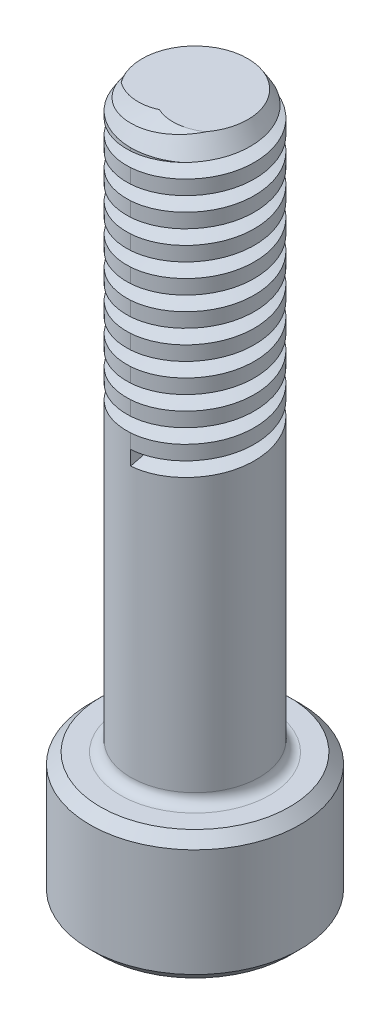
from build123d import *

# Parameters (mm, degrees)
CUT_SWEEP1_PITCH   = 0.635
CUT_EXTRUDE1_DEPTH = 1.2954
FILLET1_R          = 0.2286
FILLET2_R          = 0.396875794
CHAMFER2_SIZE      = 0.2286
CHAMFER3_SIZE      = 0.127


with BuildPart() as part:
    # Sketch1 → Revolve1 (revolve)
    with BuildSketch(Plane.XY, mode=Mode.PRIVATE) as revolve1_sk:
        Polygon((0, 0), (0, 15.5448), (1.4224, 15.5448), (1.4224, 2.8448), (2.3241, 2.8448), (2.3241, 0), align=None)
    revolve(revolve1_sk.sketch.rotate(Axis((0, 0, 0), (0, 1, 0)), 90), axis=Axis((0, 0, 0), (0, 1, 0)))

    # Cut-Sweep1: arcs per turn and ends read off the stored shape
    # Cut-Sweep1: the profile of Sketch3 profile screwed along a right-hand helix through 11 turns, 6 arcs to a turn; built about Z, then put on its axis
    cut_sweep1_z = Axis((0, 0, 0), (0, 0, 1))
    cut_sweep1_corners = [(1.4227, 0, -0.476175), (1.4227, 0, -0.793825), (0.78739873, 0, -0.635)]
    with BuildLine(mode=Mode.PRIVATE) as cut_sweep1_profile:
        Line(cut_sweep1_corners[0], cut_sweep1_corners[1])
        Line(cut_sweep1_corners[1], cut_sweep1_corners[2])
        Line(cut_sweep1_corners[2], cut_sweep1_corners[0])
    cut_sweep1_cap = Face(cut_sweep1_profile.wire())
    cut_sweep1_turn_angles = [0, 30, 60, 90, 120, 150, 180, 210, 240, 270, 300, 330, 360]
    cut_sweep1_turn_weights = [1, 0.8660254037844387, 1, 0.8660254037844387, 1, 0.8660254037844387, 1, 0.8660254037844387, 1, 0.8660254037844387, 1, 0.8660254037844387, 1]
    cut_sweep1_turn_rails = [Edge.make_bspline([Vector(p[0], p[1], 0).rotate(cut_sweep1_z, cut_sweep1_turn_angles[k]) / cut_sweep1_turn_weights[k] + Vector(0, 0, p[2] + CUT_SWEEP1_PITCH * cut_sweep1_turn_angles[k] / 360) for k in range(13)], [0, 0, 0, 1, 1, 2, 2, 3, 3, 4, 4, 5, 5, 6, 6, 6], 2, cut_sweep1_turn_weights) for p in cut_sweep1_corners]
    cut_sweep1_turn_sides = [Face.make_surface_from_curves(cut_sweep1_turn_rails[p[0]], cut_sweep1_turn_rails[p[1]]) for p in [(0, 1), (1, 2), (2, 0)]]
    cut_sweep1 = Plane(origin=(0, 15.5448, 0), x_dir=(0, 0, 1), z_dir=(0, -1, 0)) * Solid(Shell([*[p.moved(Location((0, 0, CUT_SWEEP1_PITCH * i))) for i in range(11) for p in cut_sweep1_turn_sides], cut_sweep1_cap, cut_sweep1_cap.rotate(cut_sweep1_z, 3960).moved(Location((0, 0, CUT_SWEEP1_PITCH * 3960 / 360)))]))
    add(cut_sweep1, mode=Mode.SUBTRACT)

    # Sketch4 → Cut-Extrude1 (cut)
    with BuildSketch(Plane(origin=(0, 0, 0), x_dir=(1, 0, 0), z_dir=(0, 1, 0))):
        Polygon((0, 1.378481503), (-1.1938, 0.689240751), (-1.1938, -0.689240751), (0, -1.378481503), (1.1938, -0.689240751), (1.1938, 0.689240751), align=None)
    extrude(amount=CUT_EXTRUDE1_DEPTH, mode=Mode.SUBTRACT)

    # Fillet1
    fillet1_edges = [part.edges().sort_by_distance(p)[0] for p in [
        (0, 2.8448, 1.4224),
    ]]
    fillet(fillet1_edges, radius=FILLET1_R)

    # Fillet2
    fillet2_edges = [part.edges().sort_by_distance(p)[0] for p in [
        (1.1938, 0.6477, -0.689240751),
        (0, 0.6477, -1.378481503),
        (-1.1938, 0.6477, -0.689240751),
        (-1.1938, 0.6477, 0.689240751),
        (0, 0.6477, 1.378481503),
        (1.1938, 0.6477, 0.689240751),
        (0.5969, 1.2954, -1.033861127),
        (-0.5969, 1.2954, -1.033861127),
        (-1.1938, 1.2954, 0),
        (-0.5969, 1.2954, 1.033861127),
        (0.5969, 1.2954, 1.033861127),
        (1.1938, 1.2954, 0),
    ]]
    fillet(fillet2_edges, radius=FILLET2_R)

    # Chamfer1: read off the stored shape, not the designer's step
    # Chamfer1 outline → Chamfer1 (revolve, cut)
    with BuildSketch(Plane.XY):
        Polygon((1.4224, 15.5448), (1.168399492, 15.5448), (1.4224, 15.133376279), align=None)
    revolve(axis=Axis((0, 0, 0), (0, 1, 0)), mode=Mode.SUBTRACT)

    # Chamfer2
    chamfer2_edges = [part.edges().sort_by_distance(p)[0] for p in [
        (0, 0, 2.3241),
        (0, 2.8448, 2.3241),
    ]]
    chamfer(chamfer2_edges, length=CHAMFER2_SIZE)

    # Chamfer3
    chamfer3_edges = [part.edges().sort_by_distance(p)[0] for p in [
        (0.5969, 0, -1.033861127),
        (-0.5969, 0, -1.033861127),
        (-1.1938, 0, 0),
        (-0.5969, 0, 1.033861127),
        (0.5969, 0, 1.033861127),
        (1.1938, 0, 0),
        (0, 0, -1.317084604),
        (1.140628726, 0, -0.658542302),
        (1.140628726, 0, 0.658542302),
        (0, 0, 1.317084604),
        (-1.140628726, 0, 0.658542302),
        (-1.140628726, 0, -0.658542302),
    ]]
    chamfer(chamfer3_edges, length=CHAMFER3_SIZE)


solid = part.part
